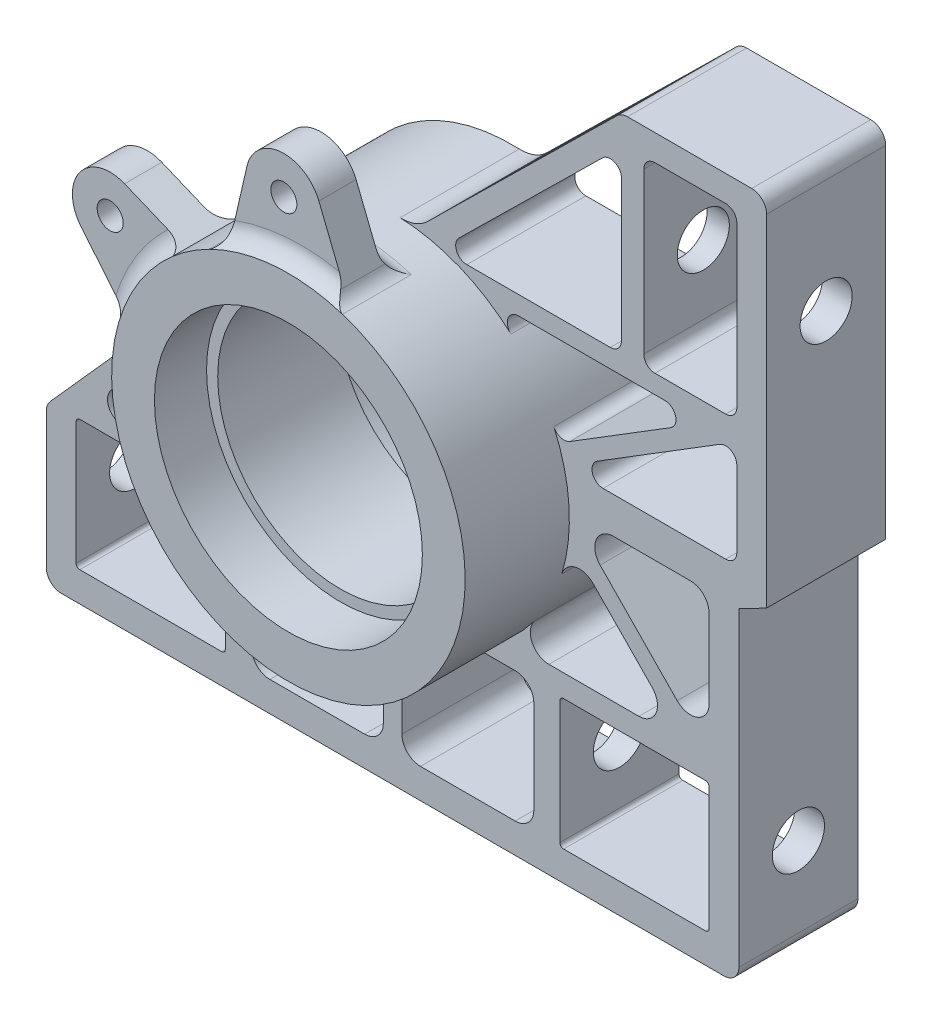
from build123d import *

# Parameters (mm, degrees)
SKETCH1_R                = 47.5
SKETCH1_R_2              = 36
BOSS_EXTRUDE1_DEPTH      = 60
BOSS_EXTRUDE2_DEPTH      = 32
FILLET4_R                = 10
CUT_EXTRUDE1_REACH       = 228.636
CUT_EXTRUDE2_DEPTH       = 64
BOSS_EXTRUDE4_DEPTH      = 16
BOSS_EXTRUDE4_DEPTH_BACK = 16
SKETCH6_R                = 36
SKETCH6_R_2              = 33
FILLET5_R                = 4
SKETCH8_R                = 10.15
SKETCH8_R_2              = 3.5
SKETCH8_R_3              = 10.150816259
BOSS_EXTRUDE6_DEPTH      = 10
FILLET12_R               = 5


with BuildPart() as part:
    # Sketch1 → Boss-Extrude1 (new body)
    with BuildSketch(Plane.XY):
        Circle(SKETCH1_R)
        Circle(SKETCH1_R_2, mode=Mode.SUBTRACT)
    extrude(amount=BOSS_EXTRUDE1_DEPTH)

    # Sketch2 → Boss-Extrude2 (add)
    with BuildSketch(Plane(origin=(0, 0, 0), x_dir=(-1, 0, 0), z_dir=(0, 0, -1))):
        with BuildLine():
            ThreePointArc((-93.05, -81.5), (-91.878427125, -84.328427125), (-89.05, -85.5))
            Line((-89.05, -85.5), (89.05, -85.5))
            ThreePointArc((89.05, -85.5), (91.878427125, -84.328427125), (93.05, -81.5))
            Line((93.05, -81.5), (93.05, -45.025163862))
            ThreePointArc((93.05, -45.025163862), (92.787529788, -43.60007752), (92.03456446, -42.362012536))
            Line((92.03456446, -42.362012536), (46.754425183, 8.382942549))
            ThreePointArc((46.754425183, 8.382942549), (47.313239142, 4.208016385), (47.5, 0))
            ThreePointArc((47.5, 0), (47.374726673, -3.447502376), (46.999567468, -6.876820327))
            ThreePointArc((46.999567468, -6.876820327), (46.85167785, -7.821143308), (46.684816708, -8.762299294))
            ThreePointArc((46.684816708, -8.762299294), (49.54342945, -5.646707476), (53.600734154, -6.837025804))
            Line((53.600734154, -6.837025804), (75.598988007, -31.49022744))
            ThreePointArc((75.598988007, -31.49022744), (76.264944422, -35.788523209), (72.614423548, -38.153378766))
            Line((72.614423548, -38.153378766), (49.95, -38.153378766))
            ThreePointArc((49.95, -38.153378766), (46.414466094, -36.688912672), (44.95, -33.153378766))
            Line((44.95, -33.153378766), (44.95, -15.354071121))
            ThreePointArc((44.95, -15.354071121), (44.659125276, -16.180622039), (44.353053198, -17.001666743))
            ThreePointArc((44.353053198, -17.001666743), (41.555802776, -23.00793897), (37.95, -28.566545118))
            Line((37.95, -28.566545118), (37.95, -72.533112291))
            ThreePointArc((37.95, -72.533112291), (36.47391714, -76.04722155), (32.950109644, -77.5))
            Line((32.950109644, -77.5), (7.5, -77.5))
            ThreePointArc((7.5, -77.5), (3.964466094, -76.035533906), (2.5, -72.5))
            Line((2.5, -72.5), (2.5, -47.434164903))
            ThreePointArc((2.5, -47.434164903), (0, -47.5), (-2.5, -47.434164903))
            Line((-2.5, -47.434164903), (-2.5, -72.5))
            ThreePointArc((-2.5, -72.5), (-3.964466094, -76.035533906), (-7.5, -77.5))
            Line((-7.5, -77.5), (-32.95, -77.5))
            ThreePointArc((-32.95, -77.5), (-36.485533906, -76.035533906), (-37.95, -72.5))
            Line((-37.95, -72.5), (-37.95, -47.5))
            ThreePointArc((-37.95, -47.5), (-36.485533906, -43.964466094), (-32.95, -42.5))
            Line((-32.95, -42.5), (-21.213203436, -42.5))
            ThreePointArc((-21.213203436, -42.5), (-27.890794752, -38.449363689), (-33.814356436, -33.359246077))
            ThreePointArc((-33.814356436, -33.359246077), (-35.989283345, -31.000346519), (-38, -28.5))
            ThreePointArc((-38, -28.5), (-37.527864045, -33.736067977), (-42, -36.5))
            Line((-42, -36.5), (-66.181051688, -36.5))
            ThreePointArc((-66.181051688, -36.5), (-70.789386546, -33.439909749), (-69.756953175, -28.005299934))
            Line((-69.756953175, -28.005299934), (-53.827303838, -11.705515781))
            ThreePointArc((-53.827303838, -11.705515781), (-49.062450426, -10.343633374), (-45.465554508, -13.752576243))
            ThreePointArc((-45.465554508, -13.752576243), (-47.40106961, 3.06408221), (-43.316596976, 19.491598868))
            ThreePointArc((-43.316596976, 19.491598868), (-45.175045505, 17.853800656), (-47.631663446, 18.171986466))
            Line((-47.631663446, 18.171986466), (-74.728376751, 34.949339249))
            ThreePointArc((-74.728376751, 34.949339249), (-76.034574712, 38.320980434), (-73.149095354, 40.5))
            Line((-73.149095354, 40.5), (-33.823069051, 40.5))
            ThreePointArc((-33.823069051, 40.5), (-31.022786179, 38.576297283), (-31.81377782, 35.272277228))
            ThreePointArc((-31.81377782, 35.272277228), (-19.902247401, 43.129462649), (-6.19459775, 47.094341048))
            Line((-6.19459775, 47.094341048), (-60.332534166, 100.351527239))
            ThreePointArc((-60.332534166, 100.351527239), (-61.622103232, 101.201763698), (-63.137670955, 101.5))
            Line((-63.137670955, 101.5), (-96.5, 101.5))
            ThreePointArc((-96.5, 101.5), (-99.328427125, 100.328427125), (-100.5, 97.5))
            Line((-100.5, 97.5), (-100.5, 5.848055119))
            Line((-100.5, 5.848055119), (-93.05, 1.964063449))
            Line((-93.05, 1.964063449), (-93.05, -81.5))
        make_face()
        with BuildLine():
            Line((-45.95, -77.5), (-84.05, -77.5))
            ThreePointArc((-84.05, -77.5), (-84.757106781, -77.207106781), (-85.05, -76.5))
            Line((-85.05, -76.5), (-85.05, -43.5))
            ThreePointArc((-85.05, -43.5), (-84.757106781, -42.792893219), (-84.05, -42.5))
            Line((-84.05, -42.5), (-45.95, -42.5))
            ThreePointArc((-45.95, -42.5), (-45.242893219, -42.792893219), (-44.95, -43.5))
            Line((-44.95, -43.5), (-44.95, -76.5))
            ThreePointArc((-44.95, -76.5), (-45.242893219, -77.207106781), (-45.95, -77.5))
        make_face(mode=Mode.SUBTRACT)
        with BuildLine():
            Line((-85.05, -24.230132308), (-85.05, -3.035936551))
            ThreePointArc((-85.05, -3.035936551), (-83.585533906, 0.499597355), (-80.05, 1.964063449))
            Line((-80.05, 1.964063449), (-59.337081151, 1.964063449))
            ThreePointArc((-59.337081151, 1.964063449), (-54.728746292, -1.096026802), (-55.761179663, -6.530636617))
            Line((-55.761179663, -6.530636617), (-76.474098513, -27.724832374))
            ThreePointArc((-76.474098513, -27.724832374), (-81.93686149, -28.860440475), (-85.05, -24.230132308))
        make_face(mode=Mode.SUBTRACT)
        with BuildLine():
            Line((84.05, -77.5), (45.95, -77.5))
            ThreePointArc((45.95, -77.5), (45.242893219, -77.207106781), (44.95, -76.5))
            Line((44.95, -76.5), (44.95, -43.5))
            ThreePointArc((44.95, -43.5), (45.242893219, -42.792893219), (45.95, -42.5))
            Line((45.95, -42.5), (84.05, -42.5))
            ThreePointArc((84.05, -42.5), (84.757106781, -42.792893219), (85.05, -43.5))
            Line((85.05, -43.5), (85.05, -76.5))
            ThreePointArc((85.05, -76.5), (84.757106781, -77.207106781), (84.05, -77.5))
        make_face(mode=Mode.SUBTRACT)
        with BuildLine():
            Line((-92.5, 14.727129287), (-92.5, 35.11400573))
            ThreePointArc((-92.5, 35.11400573), (-90.959821189, 37.734868583), (-87.920718603, 37.664666481))
            Line((-87.920718603, 37.664666481), (-54.994347362, 17.277790039))
            ThreePointArc((-54.994347362, 17.277790039), (-53.688149401, 13.906148853), (-56.573628759, 11.727129287))
            Line((-56.573628759, 11.727129287), (-89.5, 11.727129287))
            ThreePointArc((-89.5, 11.727129287), (-91.621320344, 12.605808944), (-92.5, 14.727129287))
        make_face(mode=Mode.SUBTRACT)
        with BuildLine():
            ThreePointArc((-92.5, 91.5), (-91.621320344, 93.621320344), (-89.5, 94.5))
            Line((-89.5, 94.5), (-70.5, 94.5))
            ThreePointArc((-70.5, 94.5), (-68.378679656, 93.621320344), (-67.5, 91.5))
            Line((-67.5, 91.5), (-67.5, 48.5))
            ThreePointArc((-67.5, 48.5), (-68.378679656, 46.378679656), (-70.5, 45.5))
            Line((-70.5, 45.5), (-89.5, 45.5))
            ThreePointArc((-89.5, 45.5), (-91.621320344, 46.378679656), (-92.5, 48.5))
            Line((-92.5, 48.5), (-92.5, 91.5))
        make_face(mode=Mode.SUBTRACT)
        with BuildLine():
            Line((-61.5, 48.5), (-61.5, 86.425000621))
            ThreePointArc((-61.5, 86.425000621), (-59.6594055, 89.191908442), (-56.396147408, 88.56364605))
            Line((-56.396147408, 88.56364605), (-17.843955319, 50.638645429))
            ThreePointArc((-17.843955319, 50.638645429), (-17.171485137, 47.363324208), (-19.947807911, 45.5))
            Line((-19.947807911, 45.5), (-58.5, 45.5))
            ThreePointArc((-58.5, 45.5), (-60.621320344, 46.378679656), (-61.5, 48.5))
        make_face(mode=Mode.SUBTRACT)
    extrude(amount=-BOSS_EXTRUDE2_DEPTH)

    # Fillet4
    fillet4_edges = [part.edges().sort_by_distance(p)[0] for p in [
        (6.19459775, 47.094341048, 16),
    ]]
    fillet(fillet4_edges, radius=FILLET4_R)

    # Cut-Extrude1: up to this face of the body (flat: up to its plane)
    cut_extrude1_end = Plane(part.part.faces().sort_by_distance((61.5, 67.46250031, 16))[0])
    # Sketch4 → Cut-Extrude1 (cut, up to the picked face)
    with BuildSketch(Plane(origin=(100.5, 0, 0), x_dir=(0, 0, -1), z_dir=(1, 0, 0)), mode=Mode.PRIVATE) as cut_extrude1_sk1:
        with BuildLine():
            ThreePointArc((-9, 67), (-11.050252532, 71.949747468), (-16, 74))
            Line((-16, 74), (-16, 60))
            ThreePointArc((-16, 60), (-11.050252532, 62.050252532), (-9, 67))
        make_face()
    cut_extrude1_tool1 = split(extrude(cut_extrude1_sk1.sketch, amount=-CUT_EXTRUDE1_REACH, mode=Mode.PRIVATE), bisect_by=cut_extrude1_end, keep=Keep.BOTH, mode=Mode.PRIVATE)
    # Sketch4 → Cut-Extrude1 (cut, up to the picked face)
    with BuildSketch(Plane(origin=(100.5, 0, 0), x_dir=(0, 0, -1), z_dir=(1, 0, 0)), mode=Mode.PRIVATE) as cut_extrude1_sk2:
        with BuildLine():
            Line((-16, 60), (-16, 74))
            ThreePointArc((-16, 74), (-23, 67), (-16, 60))
        make_face()
    cut_extrude1_tool2 = split(extrude(cut_extrude1_sk2.sketch, amount=-CUT_EXTRUDE1_REACH, mode=Mode.PRIVATE), bisect_by=cut_extrude1_end, keep=Keep.BOTH, mode=Mode.PRIVATE)
    # Sketch4 → Cut-Extrude1 (cut, up to the picked face)
    with BuildSketch(Plane(origin=(100.5, 0, 0), x_dir=(0, 0, -1), z_dir=(1, 0, 0)), mode=Mode.PRIVATE) as cut_extrude1_sk3:
        with BuildLine():
            ThreePointArc((-9, 67), (-11.050252532, 71.949747468), (-16, 74))
            Line((-16, 74), (-16, 60))
            ThreePointArc((-16, 60), (-11.050252532, 62.050252532), (-9, 67))
        make_face()
    cut_extrude1_tool3 = split(extrude(cut_extrude1_sk3.sketch, amount=-CUT_EXTRUDE1_REACH, mode=Mode.PRIVATE), bisect_by=cut_extrude1_end, keep=Keep.BOTH, mode=Mode.PRIVATE)
    # Sketch4 → Cut-Extrude1 (cut, up to the picked face)
    with BuildSketch(Plane(origin=(100.5, 0, 0), x_dir=(0, 0, -1), z_dir=(1, 0, 0)), mode=Mode.PRIVATE) as cut_extrude1_sk4:
        with BuildLine():
            Line((-16, 60), (-16, 74))
            ThreePointArc((-16, 74), (-23, 67), (-16, 60))
        make_face()
    cut_extrude1_tool4 = split(extrude(cut_extrude1_sk4.sketch, amount=-CUT_EXTRUDE1_REACH, mode=Mode.PRIVATE), bisect_by=cut_extrude1_end, keep=Keep.BOTH, mode=Mode.PRIVATE)
    add(cut_extrude1_tool1.solids().sort_by(Axis((100.5, 67, 13.029108), (-1, 0, 0)))[0], mode=Mode.SUBTRACT)
    add(cut_extrude1_tool2.solids().sort_by(Axis((100.5, 67, 18.970892), (-1, 0, 0)))[0], mode=Mode.SUBTRACT)
    add(cut_extrude1_tool3.solids().sort_by(Axis((100.5, 67, 13.029108), (-1, 0, 0)))[0], mode=Mode.SUBTRACT)
    add(cut_extrude1_tool4.solids().sort_by(Axis((100.5, 67, 18.970892), (-1, 0, 0)))[0], mode=Mode.SUBTRACT)

    # Sketch5 → Cut-Extrude2 (cut)
    with BuildSketch(Plane(origin=(93.05, 0, 0), x_dir=(0, 0, -1), z_dir=(1, 0, 0))):
        with BuildLine():
            ThreePointArc((-9, -60), (-11.050252532, -55.050252532), (-16, -53))
            Line((-16, -53), (-16, -67))
            ThreePointArc((-16, -67), (-11.050252532, -64.949747468), (-9, -60))
        make_face()
        with BuildLine():
            Line((-16, -67), (-16, -53))
            ThreePointArc((-16, -53), (-23, -60), (-16, -67))
        make_face()
    cut_extrude2 = extrude(amount=-CUT_EXTRUDE2_DEPTH, mode=Mode.SUBTRACT)

    # Mirror1: Cut-Extrude2 across plane
    add(cut_extrude2.mirror(Plane(origin=(0, 0, 0), x_dir=(0, 0, 1), z_dir=(1, 0, 0))), mode=Mode.SUBTRACT)

    # Sketch6 → Boss-Extrude4 (add, two sides: drawn at the far end of the back side and taken through both)
    with BuildSketch(Plane(origin=(0, 0, 30), x_dir=(-1, 0, 0), z_dir=(0, 0, -1)).offset(-BOSS_EXTRUDE4_DEPTH_BACK)):
        Circle(SKETCH6_R)
        Circle(SKETCH6_R_2, mode=Mode.SUBTRACT)
    extrude(amount=BOSS_EXTRUDE4_DEPTH + BOSS_EXTRUDE4_DEPTH_BACK)

    # Fillet5
    fillet5_edges = [part.edges().sort_by_distance(p)[0] for p in [
        (2.5, -47.434164903, 16),
        (-2.5, -47.434164903, 16),
        (-37.95, -28.566545118, 16),
    ]]
    fillet(fillet5_edges, radius=FILLET5_R)

    # Sketch8 → Boss-Extrude6 (add)
    # profile 1 of 4: a face of its own
    with BuildSketch(Plane.XY.offset(56.5)):
        with BuildLine():
            Line((-59.222959204, 26.990249925), (-45.766093405, 10.69881743))
            ThreePointArc((-45.766093405, 10.69881743), (-40.131467131, 24.463551376), (-30.477936689, 35.778420524))
            Line((-30.477936689, 35.778420524), (-47.514583839, 42.832199703))
            ThreePointArc((-47.514583839, 42.832199703), (-42.958408459, 39.093911337), (-41.247396932, 33.45423284))
            ThreePointArc((-41.247396932, 33.45423284), (-47.962790482, 23.903003676), (-59.222959204, 26.990249925))
        make_face()
    # profile 2 of 4: a face of its own
    with BuildSketch(Plane.XY.offset(56.5)):
        with Locations((-51.397396932, 33.45423284)):
            Circle(SKETCH8_R)
        with Locations((-51.397396932, 33.45423284)):
            Circle(SKETCH8_R_2, mode=Mode.SUBTRACT)
    # profile 3 of 4: a face of its own
    with BuildSketch(Plane.XY.offset(56.5)):
        with BuildLine():
            Line((12.543621914, 45.295226562), (4.694239493, 64.913993202))
            ThreePointArc((4.694239493, 64.913993202), (5.237333694, 63.063304372), (5.420570212, 61.143297904))
            ThreePointArc((5.420570212, 61.143297904), (-5.87570514, 51.057317824), (-14.622545847, 63.419583339))
            Line((-14.622545847, 63.419583339), (-19.361044575, 42.82697693))
            ThreePointArc((-19.361044575, 42.82697693), (-3.625241646, 46.859978905), (12.543621914, 45.295226562))
        make_face()
    # profile 4 of 4: a face of its own
    with BuildSketch(Plane.XY.offset(56.5)):
        with Locations((-4.730246046, 61.143297904)):
            Circle(SKETCH8_R_3)
        with Locations((-4.730246046, 61.143297904)):
            Circle(SKETCH8_R_2, mode=Mode.SUBTRACT)
    extrude(amount=-BOSS_EXTRUDE6_DEPTH)

    # Fillet12
    # the kernel refuses this fillet: 5 mm, written as the material it adds along each edge
    with BuildSketch(Plane(origin=(0, 0, 56.5), x_dir=(-0.9999100275836823, -0.01341405000734196, 0), z_dir=(0.01341405000734196, -0.9999100275836823, 0))) as fillet12_piece_1_section:
        with BuildLine():
            CenterArc((52.269696007, -5), FILLET12_R, 90, 72.542396876)
            Line((52.269696007, 0), (47.5, 0))
            Line((47.5, 0), (47.5, -3.5))
        make_face()
    fillet12_piece_1 = revolve(axis=Axis((0, 0, 56.5), (0, 0, -1)), revolution_arc=64.418761462, mode=Mode.PRIVATE)
    fillet12_piece_1 = split(fillet12_piece_1, bisect_by=Plane(origin=(8.185621098, 19.770329466, 56.5), z_dir=(-0.3825431163707949, -0.9239376408163705, 0)), keep=Keep.TOP, mode=Mode.PRIVATE)
    fillet12_piece_1 = split(fillet12_piece_1, bisect_by=Plane(origin=(-21.951486711, -18.13212011, 56.5), z_dir=(0.7709913568808224, 0.6368456073610529, 0)), keep=Keep.TOP, mode=Mode.PRIVATE)
    add(fillet12_piece_1)
    with BuildSketch(Plane(origin=(-46.165094135, 11.181864044, 56.5), x_dir=(-0.2117403626960808, -0.9773259532036036, 0), z_dir=(0, 0, -1)), Plane(origin=(-19.220548146, 43.437547456, 56.5), x_dir=(-0.9043802495207791, -0.4267275058825404, 0), z_dir=(0, 0, -1))) as fillet12_piece_2:
        with BuildLine():
            CenterArc((2.428025599, 4.998525956), FILLET12_R, 218.218634015, 50.390073067)
            Line((-1.50025305, 1.905206241), (0, 0))
            ThreePointArc((0, 0), (1.153312159, 0.014003421), (2.306624319, 0))
        make_face()
    extrude(amount=10)
    with BuildSketch(Plane(origin=(0, 0, 46.5), x_dir=(-0.9996739618401788, -0.02553370358488828, 0), z_dir=(0.02553370358488828, -0.9996739618401788, 0))) as fillet12_piece_3_section:
        with BuildLine():
            CenterArc((47.5 + FILLET12_R, FILLET12_R), FILLET12_R, 180, 90)
            Line((47.5 + FILLET12_R, 0), (47.5, 0))
            Line((47.5, 0), (47.5, FILLET12_R))
        make_face()
    fillet12_piece_3 = revolve(axis=Axis((0, 0, 46.5), (0, 0, -1)), revolution_arc=65.80784339, mode=Mode.PRIVATE)
    fillet12_piece_3 = split(fillet12_piece_3, bisect_by=Plane(origin=(8.185621098, 19.770329466, 46.5), z_dir=(-0.3825431163707949, -0.9239376408163705, 0)), keep=Keep.TOP, mode=Mode.PRIVATE)
    fillet12_piece_3 = split(fillet12_piece_3, bisect_by=Plane(origin=(-21.951486711, -18.13212011, 46.5), z_dir=(0.7709913568808224, 0.6368456073610529, 0)), keep=Keep.TOP, mode=Mode.PRIVATE)
    add(fillet12_piece_3)
    with BuildSketch(Plane(origin=(0, 0, 56.5), x_dir=(-0.6191375782460855, 0.785282534635511, 0), z_dir=(-0.785282534635511, -0.6191375782460855, 0))) as fillet12_piece_4_section:
        with BuildLine():
            CenterArc((52.269696007, -5), FILLET12_R, 90, 72.542396876)
            Line((52.269696007, 0), (47.5, 0))
            Line((47.5, 0), (47.5, -3.5))
        make_face()
    fillet12_piece_4 = revolve(axis=Axis((0, 0, 56.5), (0, 0, -1)), revolution_arc=67.658810575, mode=Mode.PRIVATE)
    fillet12_piece_4 = split(fillet12_piece_4, bisect_by=Plane(origin=(-27.746661299, 6.384695393, 56.5), z_dir=(0.9745324462826352, -0.22424654098197985, 0)), keep=Keep.TOP, mode=Mode.PRIVATE)
    fillet12_piece_4 = split(fillet12_piece_4, bisect_by=Plane(origin=(26.434500922, 10.576327791, 56.5), z_dir=(-0.9284460775917646, -0.3714672004423367, 0)), keep=Keep.TOP, mode=Mode.PRIVATE)
    add(fillet12_piece_4)
    with BuildSketch(Plane(origin=(12.310887822, 45.87692275, 56.5), x_dir=(0.9592523435499558, -0.28255077666486333, 0), z_dir=(0, 0, -1))) as fillet12_piece_5:
        with BuildLine():
            CenterArc((2.428025599, -4.998525956), FILLET12_R, 91.391292918, 50.390073067)
            Line((-1.50025305, -1.905206241), (0, 0))
            ThreePointArc((0, 0), (1.153312159, -0.014003421), (2.306624319, 0))
        make_face()
    extrude(amount=10)
    with BuildSketch(Plane(origin=(0, 0, 46.5), x_dir=(-0.6286111852065409, 0.7777197296155136, 0), z_dir=(-0.7777197296155136, -0.6286111852065409, 0))) as fillet12_piece_6_section:
        with BuildLine():
            CenterArc((47.5 + FILLET12_R, FILLET12_R), FILLET12_R, 180, 90)
            Line((47.5 + FILLET12_R, 0), (47.5, 0))
            Line((47.5, 0), (47.5, FILLET12_R))
        make_face()
    fillet12_piece_6 = revolve(axis=Axis((0, 0, 46.5), (0, 0, -1)), revolution_arc=69.047909135, mode=Mode.PRIVATE)
    fillet12_piece_6 = split(fillet12_piece_6, bisect_by=Plane(origin=(-27.746661299, 6.384695393, 46.5), z_dir=(0.9745324462826352, -0.22424654098197985, 0)), keep=Keep.TOP, mode=Mode.PRIVATE)
    fillet12_piece_6 = split(fillet12_piece_6, bisect_by=Plane(origin=(26.434500922, 10.576327791, 46.5), z_dir=(-0.9284460775917646, -0.3714672004423367, 0)), keep=Keep.TOP, mode=Mode.PRIVATE)
    add(fillet12_piece_6)
    with BuildSketch(Plane(origin=(0, 0, 56.5), x_dir=(-0.9999100275836823, -0.01341405000734196, 0), z_dir=(0.01341405000734196, -0.9999100275836823, 0))) as fillet12_piece_7a_section:
        with BuildLine():
            CenterArc((52.269696007, -5), FILLET12_R, 90, 72.542396876)
            Line((52.269696007, 0), (47.5, 0))
            Line((47.5, 0), (47.5, -3.5))
        make_face()
    fillet12_piece_7a = revolve(axis=Axis((0, 0, 56.5), (0, 0, -1)), revolution_arc=64.418761462, mode=Mode.PRIVATE)
    fillet12_piece_7a = split(fillet12_piece_7a, bisect_by=Plane(origin=(-21.951486711, -18.13212011, 56.5), z_dir=(-0.7709913568808224, -0.6368456073610529, 0)), keep=Keep.TOP, mode=Mode.PRIVATE)
    with BuildSketch(Plane(origin=(-46.165094135, 11.181864044, 62.562471668), x_dir=(-0.2117403626960808, -0.9773259532036036, 0), z_dir=(0, 0, -1))) as fillet12_piece_7b_section:
        with BuildLine():
            CenterArc((2.428025599, 4.998525956), FILLET12_R, 218.218634015, 50.390073067)
            Line((-1.50025305, 1.905206241), (0, 0))
            ThreePointArc((0, 0), (1.153312159, 0.014003421), (2.306624319, 0))
        make_face()
    fillet12_piece_7b = extrude(amount=16.062471668, mode=Mode.PRIVATE)
    fillet12_piece_7b = split(fillet12_piece_7b, bisect_by=Plane(origin=(-46.165094135, 11.181864044, 60), z_dir=(0, 0, -1)), keep=Keep.TOP, mode=Mode.PRIVATE)
    fillet12_piece_7b = split(fillet12_piece_7b, bisect_by=Plane(origin=(-46.165094135, 11.181864044, 56.5), z_dir=(0, 0, 1)), keep=Keep.TOP, mode=Mode.PRIVATE)
    fillet12_piece_7 = fillet12_piece_7a & fillet12_piece_7b
    add(fillet12_piece_7)
    with BuildSketch(Plane(origin=(0, 0, 46.5), x_dir=(-0.9996739618401788, -0.02553370358488828, 0), z_dir=(0.02553370358488828, -0.9996739618401788, 0))) as fillet12_piece_8a_section:
        with BuildLine():
            CenterArc((47.5 + FILLET12_R, FILLET12_R), FILLET12_R, 180, 90)
            Line((47.5 + FILLET12_R, 0), (47.5, 0))
            Line((47.5, 0), (47.5, FILLET12_R))
        make_face()
    fillet12_piece_8a = revolve(axis=Axis((0, 0, 46.5), (0, 0, -1)), revolution_arc=65.80784339, mode=Mode.PRIVATE)
    fillet12_piece_8a = split(fillet12_piece_8a, bisect_by=Plane(origin=(-21.951486711, -18.13212011, 46.5), z_dir=(-0.7709913568808224, -0.6368456073610529, 0)), keep=Keep.TOP, mode=Mode.PRIVATE)
    with BuildSketch(Plane(origin=(-46.165094135, 11.181864044, 56.5), x_dir=(-0.2117403626960808, -0.9773259532036036, 0), z_dir=(0, 0, -1))) as fillet12_piece_8b_section:
        with BuildLine():
            CenterArc((2.428025599, 4.998525956), FILLET12_R, 218.218634015, 50.390073067)
            Line((-1.50025305, 1.905206241), (0, 0))
            ThreePointArc((0, 0), (1.153312159, 0.014003421), (2.306624319, 0))
        make_face()
    fillet12_piece_8b = extrude(amount=16.062471668, mode=Mode.PRIVATE)
    fillet12_piece_8b = split(fillet12_piece_8b, bisect_by=Plane(origin=(-46.165094135, 11.181864044, 46.5), z_dir=(0, 0, -1)), keep=Keep.TOP, mode=Mode.PRIVATE)
    fillet12_piece_8 = fillet12_piece_8a & fillet12_piece_8b
    add(fillet12_piece_8)
    with BuildSketch(Plane(origin=(0, 0, 56.5), x_dir=(-0.6191375782460855, 0.785282534635511, 0), z_dir=(-0.785282534635511, -0.6191375782460855, 0))) as fillet12_piece_9a_section:
        with BuildLine():
            CenterArc((52.269696007, -5), FILLET12_R, 90, 72.542396876)
            Line((52.269696007, 0), (47.5, 0))
            Line((47.5, 0), (47.5, -3.5))
        make_face()
    fillet12_piece_9a = revolve(axis=Axis((0, 0, 56.5), (0, 0, -1)), revolution_arc=67.658810575, mode=Mode.PRIVATE)
    fillet12_piece_9a = split(fillet12_piece_9a, bisect_by=Plane(origin=(-27.746661299, 6.384695393, 56.5), z_dir=(-0.9745324462826352, 0.22424654098197985, 0)), keep=Keep.TOP, mode=Mode.PRIVATE)
    with BuildSketch(Plane(origin=(-19.220548146, 43.437547456, 62.562471668), x_dir=(-0.9043802495207791, -0.4267275058825404, 0), z_dir=(0, 0, -1))) as fillet12_piece_9b_section:
        with BuildLine():
            CenterArc((2.428025599, 4.998525956), FILLET12_R, 218.218634015, 50.390073067)
            Line((-1.50025305, 1.905206241), (0, 0))
            ThreePointArc((0, 0), (1.153312159, 0.014003421), (2.306624319, 0))
        make_face()
    fillet12_piece_9b = extrude(amount=16.062471668, mode=Mode.PRIVATE)
    fillet12_piece_9b = split(fillet12_piece_9b, bisect_by=Plane(origin=(-19.220548146, 43.437547456, 60), z_dir=(0, 0, -1)), keep=Keep.TOP, mode=Mode.PRIVATE)
    fillet12_piece_9b = split(fillet12_piece_9b, bisect_by=Plane(origin=(-19.220548146, 43.437547456, 56.5), z_dir=(0, 0, 1)), keep=Keep.TOP, mode=Mode.PRIVATE)
    fillet12_piece_9 = fillet12_piece_9a & fillet12_piece_9b
    add(fillet12_piece_9)
    with BuildSketch(Plane(origin=(0, 0, 56.5), x_dir=(-0.6191375782460855, 0.785282534635511, 0), z_dir=(-0.785282534635511, -0.6191375782460855, 0))) as fillet12_piece_10a_section:
        with BuildLine():
            CenterArc((52.269696007, -5), FILLET12_R, 90, 72.542396876)
            Line((52.269696007, 0), (47.5, 0))
            Line((47.5, 0), (47.5, -3.5))
        make_face()
    fillet12_piece_10a = revolve(axis=Axis((0, 0, 56.5), (0, 0, -1)), revolution_arc=67.658810575, mode=Mode.PRIVATE)
    fillet12_piece_10a = split(fillet12_piece_10a, bisect_by=Plane(origin=(26.434500922, 10.576327791, 56.5), z_dir=(0.9284460775917646, 0.3714672004423367, 0)), keep=Keep.TOP, mode=Mode.PRIVATE)
    with BuildSketch(Plane(origin=(12.310887822, 45.87692275, 62.562471668), x_dir=(0.9592523435499558, -0.28255077666486333, 0), z_dir=(0, 0, -1))) as fillet12_piece_10b_section:
        with BuildLine():
            CenterArc((2.428025599, -4.998525956), FILLET12_R, 91.391292918, 50.390073067)
            Line((-1.50025305, -1.905206241), (0, 0))
            ThreePointArc((0, 0), (1.153312159, -0.014003421), (2.306624319, 0))
        make_face()
    fillet12_piece_10b = extrude(amount=16.062471668, mode=Mode.PRIVATE)
    fillet12_piece_10b = split(fillet12_piece_10b, bisect_by=Plane(origin=(12.310887822, 45.87692275, 60), z_dir=(0, 0, -1)), keep=Keep.TOP, mode=Mode.PRIVATE)
    fillet12_piece_10b = split(fillet12_piece_10b, bisect_by=Plane(origin=(12.310887822, 45.87692275, 56.5), z_dir=(0, 0, 1)), keep=Keep.TOP, mode=Mode.PRIVATE)
    fillet12_piece_10 = fillet12_piece_10a & fillet12_piece_10b
    add(fillet12_piece_10)
    with BuildSketch(Plane(origin=(0, 0, 46.5), x_dir=(-0.6286111852065409, 0.7777197296155136, 0), z_dir=(-0.7777197296155136, -0.6286111852065409, 0))) as fillet12_piece_11a_section:
        with BuildLine():
            CenterArc((47.5 + FILLET12_R, FILLET12_R), FILLET12_R, 180, 90)
            Line((47.5 + FILLET12_R, 0), (47.5, 0))
            Line((47.5, 0), (47.5, FILLET12_R))
        make_face()
    fillet12_piece_11a = revolve(axis=Axis((0, 0, 46.5), (0, 0, -1)), revolution_arc=69.047909135, mode=Mode.PRIVATE)
    fillet12_piece_11a = split(fillet12_piece_11a, bisect_by=Plane(origin=(26.434500922, 10.576327791, 46.5), z_dir=(0.9284460775917646, 0.3714672004423367, 0)), keep=Keep.TOP, mode=Mode.PRIVATE)
    with BuildSketch(Plane(origin=(12.310887822, 45.87692275, 56.5), x_dir=(0.9592523435499558, -0.28255077666486333, 0), z_dir=(0, 0, -1))) as fillet12_piece_11b_section:
        with BuildLine():
            CenterArc((2.428025599, -4.998525956), FILLET12_R, 91.391292918, 50.390073067)
            Line((-1.50025305, -1.905206241), (0, 0))
            ThreePointArc((0, 0), (1.153312159, -0.014003421), (2.306624319, 0))
        make_face()
    fillet12_piece_11b = extrude(amount=16.062471668, mode=Mode.PRIVATE)
    fillet12_piece_11b = split(fillet12_piece_11b, bisect_by=Plane(origin=(12.310887822, 45.87692275, 46.5), z_dir=(0, 0, -1)), keep=Keep.TOP, mode=Mode.PRIVATE)
    fillet12_piece_11 = fillet12_piece_11a & fillet12_piece_11b
    add(fillet12_piece_11)
    with BuildSketch(Plane(origin=(-19.220548146, 43.437547456, 56.5), x_dir=(-0.9043802495207791, -0.4267275058825404, 0), z_dir=(0, 0, -1))) as fillet12_piece_12a_section:
        with BuildLine():
            CenterArc((2.428025599, 4.998525956), FILLET12_R, 218.218634015, 50.390073067)
            Line((-1.50025305, 1.905206241), (0, 0))
            ThreePointArc((0, 0), (1.153312159, 0.014003421), (2.306624319, 0))
        make_face()
    fillet12_piece_12a = extrude(amount=16.062471668, mode=Mode.PRIVATE)
    fillet12_piece_12a = split(fillet12_piece_12a, bisect_by=Plane(origin=(-19.220548146, 43.437547456, 46.5), z_dir=(0, 0, -1)), keep=Keep.TOP, mode=Mode.PRIVATE)
    with BuildSketch(Plane(origin=(0, 0, 46.5), x_dir=(-0.6286111852065409, 0.7777197296155136, 0), z_dir=(-0.7777197296155136, -0.6286111852065409, 0))) as fillet12_piece_12b_section:
        with BuildLine():
            CenterArc((47.5 + FILLET12_R, FILLET12_R), FILLET12_R, 180, 90)
            Line((47.5 + FILLET12_R, 0), (47.5, 0))
            Line((47.5, 0), (47.5, FILLET12_R))
        make_face()
    fillet12_piece_12b = revolve(axis=Axis((0, 0, 46.5), (0, 0, -1)), revolution_arc=69.047909135, mode=Mode.PRIVATE)
    fillet12_piece_12b = split(fillet12_piece_12b, bisect_by=Plane(origin=(-27.746661299, 6.384695393, 46.5), z_dir=(-0.9745324462826352, 0.22424654098197985, 0)), keep=Keep.TOP, mode=Mode.PRIVATE)
    fillet12_piece_12 = fillet12_piece_12a & fillet12_piece_12b
    add(fillet12_piece_12)


solid = part.part
